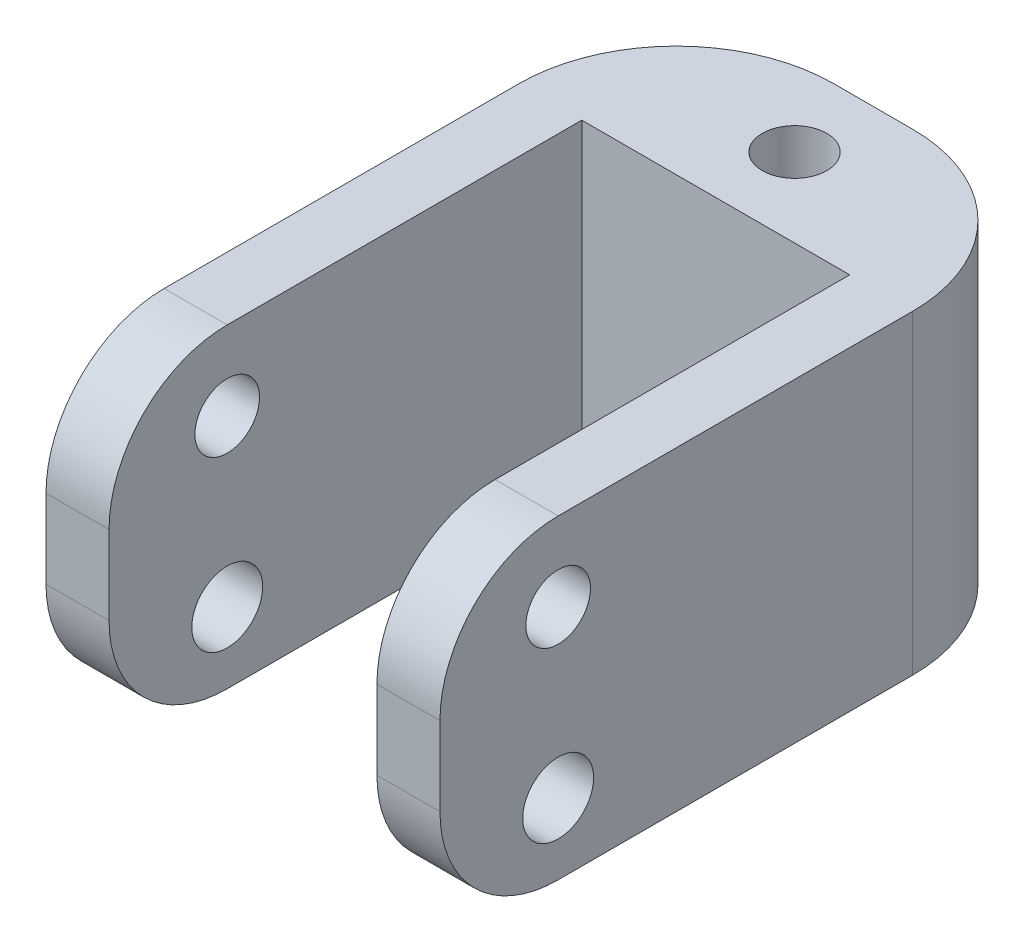
from build123d import *

# Parameters (mm, degrees)
SKETCH4_W               = 80
SKETCH4_H               = 40
SKETCH4_R               = 4.1
SKETCH4_R_2             = 4.5
BOSS_EXTRUDE2_DEPTH     = 25
CUT_EXTRUDE3_DEPTH      = 52.23475383
CUT_EXTRUDE3_DEPTH_BACK = 52.23475383
SKETCH5_W               = 34
SKETCH5_H               = 60
CUT_EXTRUDE4_DEPTH      = 52.23475383
CUT_EXTRUDE4_DEPTH_BACK = 52.23475383
SKETCH6_R               = 4.1
FILLET1_R               = 20
FILLET3_R               = 15


with BuildPart() as part:
    # Sketch4 → Boss-Extrude2 (new, symmetric)
    with BuildSketch(Plane(origin=(0, 0, 0), x_dir=(0, 0, -1), z_dir=(1, 0, 0))):
        Rectangle(SKETCH4_W, SKETCH4_H)
        with Locations((-25, 10)):
            Circle(SKETCH4_R, mode=Mode.SUBTRACT)
        with Locations((-25, -11)):
            Circle(SKETCH4_R_2, mode=Mode.SUBTRACT)
    extrude(amount=BOSS_EXTRUDE2_DEPTH, both=True)

    # Sketch5 → Cut-Extrude3 (cut, two sides: drawn at the far end of the back side and taken through both)
    with BuildSketch(Plane(origin=(0, 0, 0), x_dir=(1, 0, 0), z_dir=(0, 1, 0)).offset(-CUT_EXTRUDE3_DEPTH_BACK)):
        with Locations((0, -10)):
            Rectangle(SKETCH5_W, SKETCH5_H)
    extrude(amount=CUT_EXTRUDE3_DEPTH + CUT_EXTRUDE3_DEPTH_BACK, mode=Mode.SUBTRACT)

    # Sketch6 → Cut-Extrude4 (cut, two sides: drawn at the far end of the back side and taken through both)
    with BuildSketch(Plane(origin=(0, 0, 0), x_dir=(1, 0, 0), z_dir=(0, 1, 0)).offset(-CUT_EXTRUDE4_DEPTH_BACK)):
        with Locations((0, 30)):
            Circle(SKETCH6_R)
    extrude(amount=CUT_EXTRUDE4_DEPTH + CUT_EXTRUDE4_DEPTH_BACK, mode=Mode.SUBTRACT)

    # Fillet1
    fillet1_edges = [part.edges().sort_by_distance(p)[0] for p in [
        (-25, 0, -40),
        (25, 0, -40),
    ]]
    fillet(fillet1_edges, radius=FILLET1_R)

    # Fillet3
    fillet3_edges = [part.edges().sort_by_distance(p)[0] for p in [
        (-21, 20, 40),
        (-21, -20, 40),
        (21, -20, 40),
        (21, 20, 40),
    ]]
    fillet(fillet3_edges, radius=FILLET3_R)


solid = part.part
